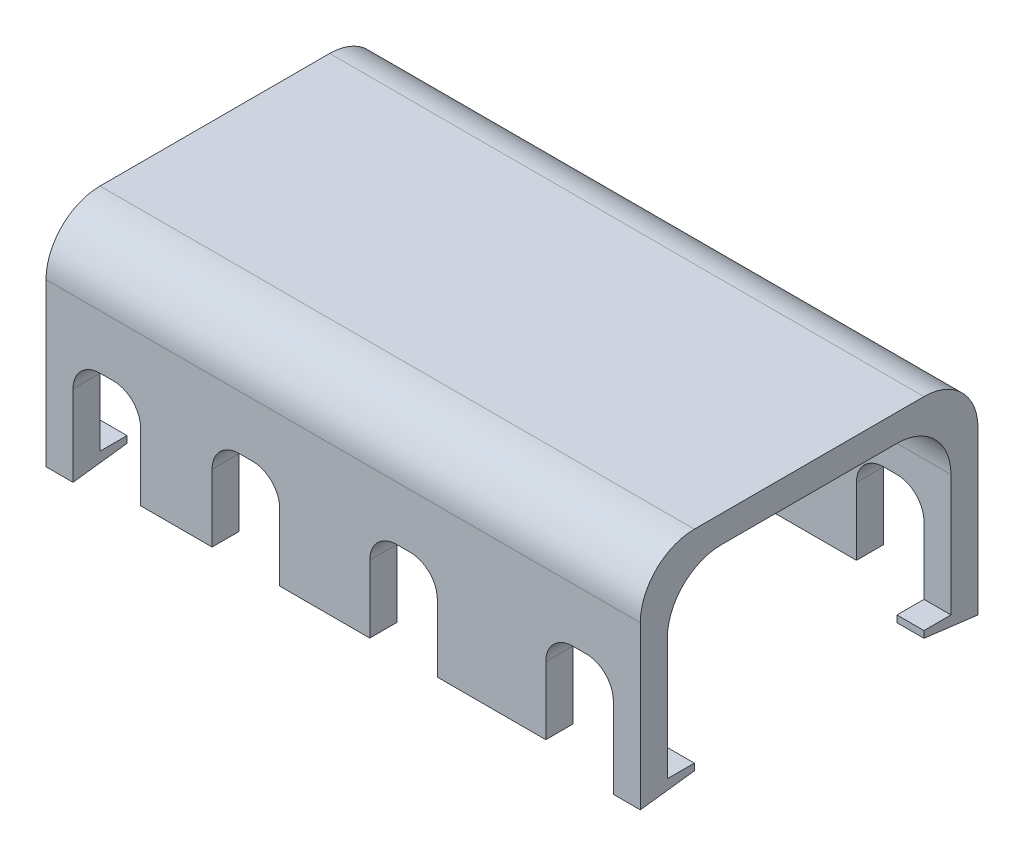
from build123d import *

# Parameters (mm, degrees)
ESBO_O1_W                = 44
ESBO_O1_H                = 25
RESSALTO_EXTRUS_O1_DEPTH = 7.5
CASCA1_T                 = -2
ESBO_O2_W                = 5
ESBO_O2_H                = 14
CORTE_EXTRUS_O1_DEPTH    = 35.135758377
FILETE1_R                = 2
FILETE2_R                = 4
RESSALTO_EXTRUS_O2_DEPTH = 2


with BuildPart() as part:
    # Esboço1 → Ressalto-extrusão1 (new, symmetric)
    with BuildSketch(Plane(origin=(0, 0, 0), x_dir=(1, 0, 0), z_dir=(0, 1, 0))):
        Rectangle(ESBO_O1_W, ESBO_O1_H)
    extrude(amount=RESSALTO_EXTRUS_O1_DEPTH, both=True)

    # Casca1
    casca1_openings = [part.faces().sort_by_distance(p)[0] for p in [
        (0, -7.5, 0),
        (-22, 0, 0),
        (22, 0, 0),
    ]]
    offset(amount=CASCA1_T, openings=casca1_openings, kind=Kind.INTERSECTION)

    # Esboço2 → Corte-extrusão1 (cut, through all)
    with BuildSketch(Plane.XY.offset(12.5)):
        with Locations((-7.203332481, -7.5)):
            Rectangle(ESBO_O2_W, ESBO_O2_H)
        with Locations((-17.5, -7.5)):
            Rectangle(ESBO_O2_W, ESBO_O2_H)
        with Locations((4.47023527, -7.5)):
            Rectangle(ESBO_O2_W, ESBO_O2_H)
        with Locations((17.5, -7.5)):
            Rectangle(ESBO_O2_W, ESBO_O2_H)
    extrude(amount=-CORTE_EXTRUS_O1_DEPTH, mode=Mode.SUBTRACT)

    # Filete1
    filete1_edges = [part.edges().sort_by_distance(p)[0] for p in [
        (15, -0.5, 11.5),
        (15, -0.5, -11.5),
        (20, -0.5, 11.5),
        (20, -0.5, -11.5),
        (1.97023527, -0.5, 11.5),
        (1.97023527, -0.5, -11.5),
        (6.97023527, -0.5, 11.5),
        (6.97023527, -0.5, -11.5),
        (-9.703332481, -0.5, 11.5),
        (-9.703332481, -0.5, -11.5),
        (-4.703332481, -0.5, 11.5),
        (-4.703332481, -0.5, -11.5),
        (-15, -0.5, 11.5),
        (-15, -0.5, -11.5),
        (-20, -0.5, -11.5),
        (-20, -0.5, 11.5),
    ]]
    fillet(filete1_edges, radius=FILETE1_R)

    # Filete2
    filete2_edges = [part.edges().sort_by_distance(p)[0] for p in [
        (0, 7.5, -12.5),
        (0, 7.5, 12.5),
        (0, 5.5, 10.5),
        (0, 5.5, -10.5),
    ]]
    fillet(filete2_edges, radius=FILETE2_R)

    # Esboço3 → Ressalto-extrusão2 (add)
    with BuildSketch(Plane(origin=(-22, 0, 0), x_dir=(0, 0, -1), z_dir=(1, 0, 0))):
        Polygon((10.5, -7.5), (8.5, -7.5), (8.5, -8), (12.5, -8.5), (12.5, -7.5), align=None)
        Polygon((-8.5, -8), (-12.5, -8.5), (-12.5, -7.5), (-10.5, -7.5), (-8.5, -7.5), align=None)
    ressalto_extrus_o2 = extrude(amount=RESSALTO_EXTRUS_O2_DEPTH)

    # Espelhar1: Ressalto-extrusão2 across plane
    add(ressalto_extrus_o2.mirror(Plane(origin=(0, 0, 0), x_dir=(0, 0, 1), z_dir=(1, 0, 0))))


solid = part.part
